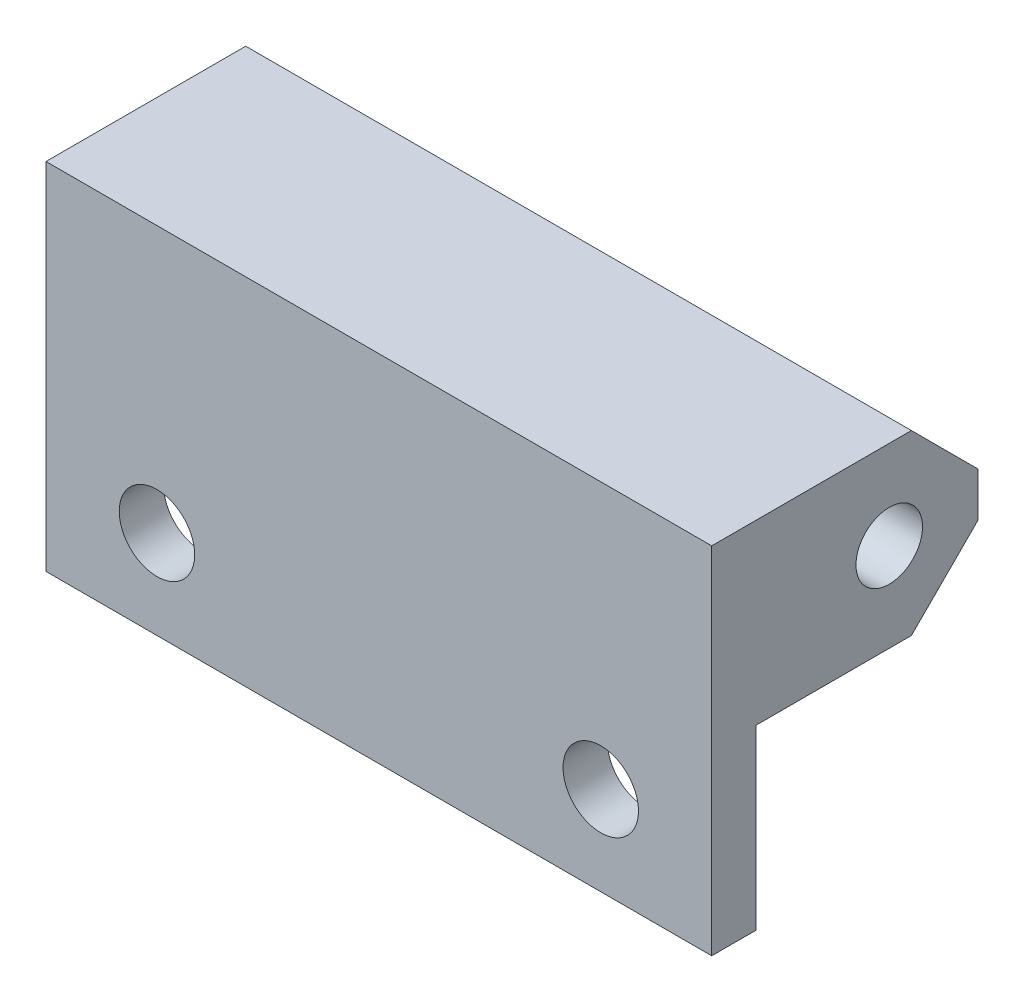
from build123d import *

# Parameters (mm, degrees)
BOSS_EXTRUDE1_DEPTH     = 15
M3_CLEARANCE_HOLE1_D    = 3.4
CUT_EXTRUDE1_DEPTH      = 33.062439084
CUT_EXTRUDE1_DEPTH_BACK = 33.062439084
SKETCH4_R               = 1.5


with BuildPart() as part:
    # Sketch1 → Boss-Extrude1 (new, symmetric)
    with BuildSketch(Plane(origin=(0, 0, 0), x_dir=(0, 0, -1), z_dir=(1, 0, 0))):
        Polygon((-8, 8), (0, 8), (1, 8), (4, 5), (4, 3), (1, 0), (0, 0), (-6, 0), (-6, -8), (-8, -8), align=None)
    extrude(amount=BOSS_EXTRUDE1_DEPTH, both=True)

    # M3 Clearance Hole1 (through all)
    with Locations(Plane(origin=(0, 0, 6), x_dir=(-1, 0, 0), z_dir=(0, 0, -1))):
        with Locations((-10, -4), (10, -4)):
            Hole(M3_CLEARANCE_HOLE1_D / 2)

    # Sketch4 → Cut-Extrude1 (cut, two sides: drawn at the far end of the back side and taken through both)
    with BuildSketch(Plane(origin=(15, 0, 0), x_dir=(0, 0, -1), z_dir=(1, 0, 0)).offset(-CUT_EXTRUDE1_DEPTH_BACK)):
        with Locations((0, 4)):
            Circle(SKETCH4_R)
    extrude(amount=CUT_EXTRUDE1_DEPTH + CUT_EXTRUDE1_DEPTH_BACK, mode=Mode.SUBTRACT)


solid = part.part
